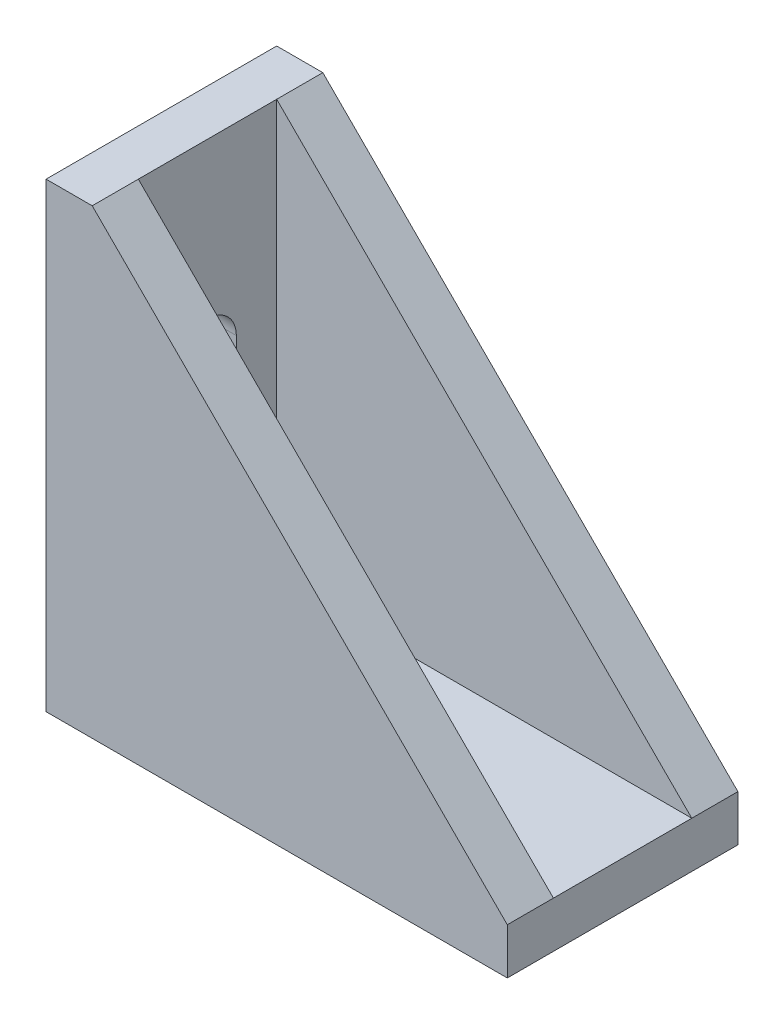
from build123d import *

# Parameters (mm, degrees)
SKETCH1_W           = 40
SKETCH1_H           = 20
BOSS_EXTRUDE1_DEPTH = 4
SKETCH2_W           = 20
SKETCH2_H           = 40
BOSS_EXTRUDE2_DEPTH = 4
BOSS_EXTRUDE3_DEPTH = 4
CUT_EXTRUDE1_DEPTH  = 4
CUT_EXTRUDE2_DEPTH  = 4


with BuildPart() as part:
    # Sketch1 → Boss-Extrude1 (new body)
    with BuildSketch(Plane(origin=(0, 0, 0), x_dir=(1, 0, 0), z_dir=(0, 1, 0))):
        Rectangle(SKETCH1_W, SKETCH1_H)
    extrude(amount=BOSS_EXTRUDE1_DEPTH)

    # Sketch2 → Boss-Extrude2 (add)
    with BuildSketch(Plane.ZY.offset(20)):
        with Locations((0, 20)):
            Rectangle(SKETCH2_W, SKETCH2_H)
    extrude(amount=-BOSS_EXTRUDE2_DEPTH)

    # Sketch3 → Boss-Extrude3 (add)
    with BuildSketch(Plane.XY.offset(10)):
        Polygon((-20, 0), (-20, 40), (-16, 40), (20, 4), (20, 0), align=None)
    boss_extrude3 = extrude(amount=-BOSS_EXTRUDE3_DEPTH)

    # Mirror1: Boss-Extrude3 across plane
    add(boss_extrude3.mirror(Plane.XY))

    # Sketch4 → Cut-Extrude1 (cut)
    with BuildSketch(Plane(origin=(0, 4, 0), x_dir=(1, 0, 0), z_dir=(0, 1, 0))):
        with BuildLine():
            Line((-2, 2.5), (2, 2.5))
            ThreePointArc((2, 2.5), (4.5, 0), (2, -2.5))
            Line((2, -2.5), (-2, -2.5))
            ThreePointArc((-2, -2.5), (-4.5, 0), (-2, 2.5))
        make_face()
    extrude(amount=-CUT_EXTRUDE1_DEPTH, mode=Mode.SUBTRACT)

    # Sketch5 → Cut-Extrude2 (cut)
    with BuildSketch(Plane(origin=(-16, 0, 0), x_dir=(0, 0, -1), z_dir=(1, 0, 0))):
        with BuildLine():
            Line((2.5, 24), (2.5, 20))
            ThreePointArc((2.5, 20), (0, 17.5), (-2.5, 20))
            Line((-2.5, 20), (-2.5, 24))
            ThreePointArc((-2.5, 24), (0, 26.5), (2.5, 24))
        make_face()
    extrude(amount=-CUT_EXTRUDE2_DEPTH, mode=Mode.SUBTRACT)


solid = part.part
